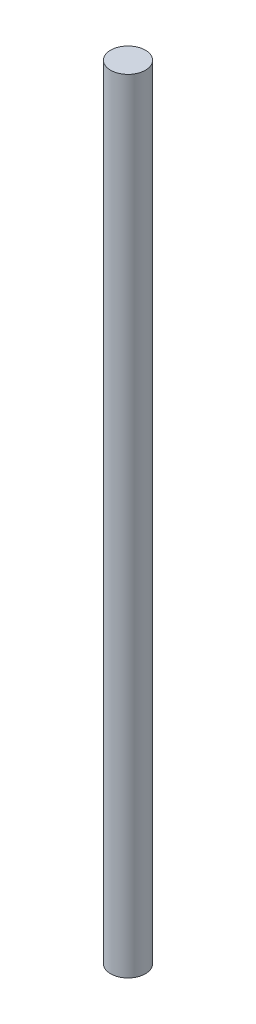
from build123d import *

# Parameters (mm, degrees)
SKETCH1_R           = 4
BOSS_EXTRUDE1_DEPTH = 180


with BuildPart() as part:
    # Sketch1 → Boss-Extrude1 (new body)
    with BuildSketch(Plane(origin=(0, 0, 0), x_dir=(1, 0, 0), z_dir=(0, 1, 0))):
        Circle(SKETCH1_R)
    extrude(amount=BOSS_EXTRUDE1_DEPTH)


solid = part.part
